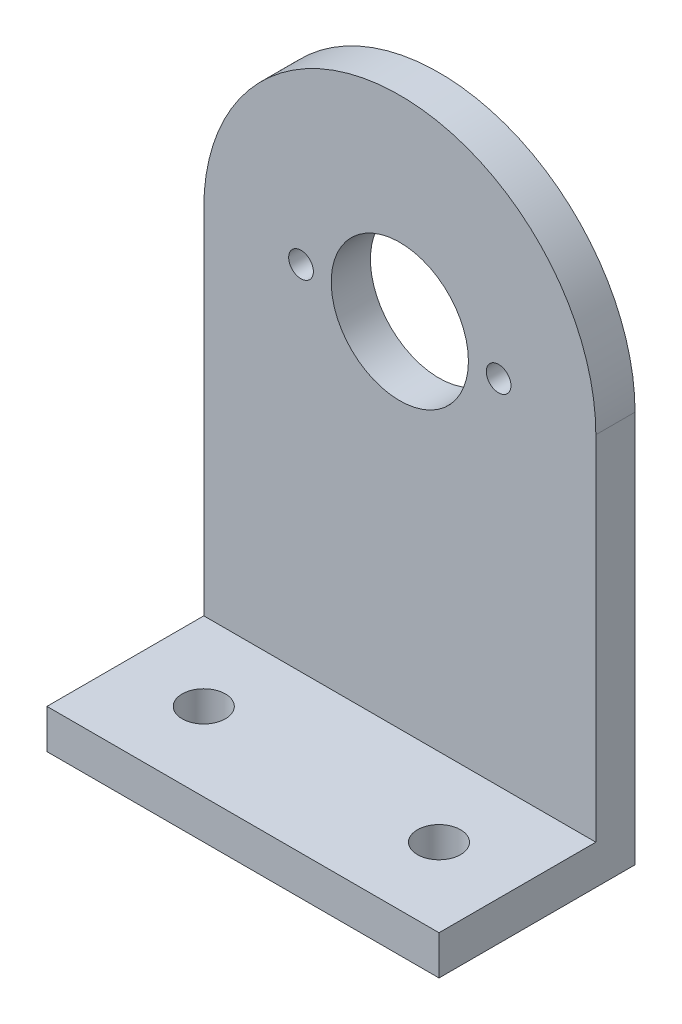
from build123d import *

# Parameters (mm, degrees)
SKETCH1_R                 = 15.875
SKETCH1_W                 = 31.75
SKETCH1_H                 = 31.75
BOSS_EXTRUDE1_DEPTH       = 3.175
SKETCH3_R                 = 5.55625
CUT_EXTRUDE1_DEPTH        = 36.639286609
SKETCH4_W                 = 31.75
SKETCH4_H                 = 3.175
BOSS_EXTRUDE2_DEPTH       = 12.7
SKETCH5_R                 = 1.75
CUT_EXTRUDE2_DEPTH        = 50.797929174
F_2_0MM_DOWEL_HOLE1_D     = 2
F_2_0MM_DOWEL_HOLE1_DEPTH = 12.7
F_2_0MM_DOWEL_HOLE1_TIP   = 0.600860619
CHAMFER1_SIZE             = 0.762


with BuildPart() as part:
    # Sketch1 → Boss-Extrude1 (new body)
    with BuildSketch(Plane.XY):
        Circle(SKETCH1_R)
        with Locations((0, -15.875)):
            Rectangle(SKETCH1_W, SKETCH1_H)
    extrude(amount=BOSS_EXTRUDE1_DEPTH)

    # Sketch3 → Cut-Extrude1 (cut, through all)
    with BuildSketch(Plane.XY.offset(3.175)):
        Circle(SKETCH3_R)
    extrude(amount=-CUT_EXTRUDE1_DEPTH, mode=Mode.SUBTRACT)

    # Sketch4 → Boss-Extrude2 (add)
    with BuildSketch(Plane.XY.offset(3.175)):
        with Locations((0, -30.1625)):
            Rectangle(SKETCH4_W, SKETCH4_H)
    extrude(amount=BOSS_EXTRUDE2_DEPTH)

    # Sketch5 → Cut-Extrude2 (cut, through all)
    with BuildSketch(Plane(origin=(0, -28.575, 0), x_dir=(1, 0, 0), z_dir=(0, 1, 0))):
        with Locations((-9.525, -9.525)):
            Circle(SKETCH5_R)
        with Locations((9.525, -9.525)):
            Circle(SKETCH5_R)
    extrude(amount=-CUT_EXTRUDE2_DEPTH, mode=Mode.SUBTRACT)

    # Ø2.0mm Dowel Hole1
    with Locations(Plane.XY.offset(3.175)):
        with Locations((-8.001, 0), (8.001, 0)):
            Hole(F_2_0MM_DOWEL_HOLE1_D / 2, depth=F_2_0MM_DOWEL_HOLE1_DEPTH)
            with Locations((0, 0, -(F_2_0MM_DOWEL_HOLE1_DEPTH + F_2_0MM_DOWEL_HOLE1_TIP / 2))):  # 118° drill point
                Cone(0, F_2_0MM_DOWEL_HOLE1_D / 2, F_2_0MM_DOWEL_HOLE1_TIP, mode=Mode.SUBTRACT)

    # Chamfer1
    chamfer1_edges = [part.edges().sort_by_distance(p)[0] for p in [
        (-7.001, 0, 0),
        (9.001, 0, 0),
    ]]
    chamfer(chamfer1_edges, length=CHAMFER1_SIZE)


solid = part.part
